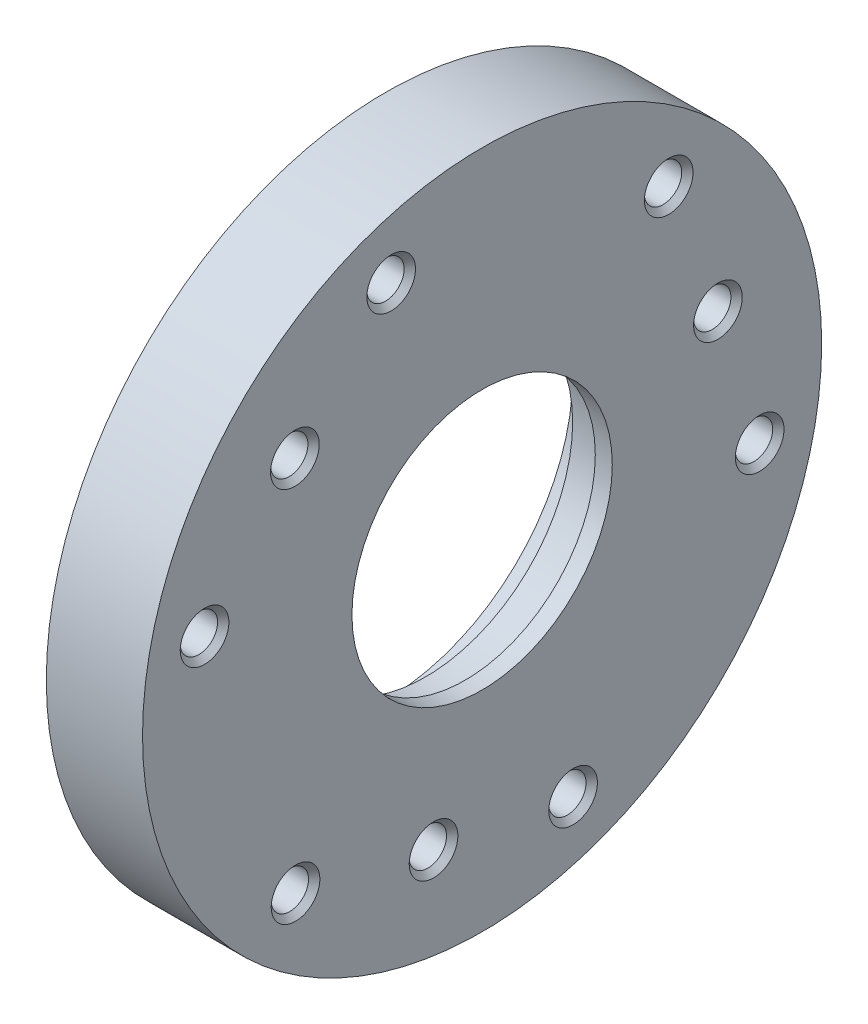
from build123d import *

# Parameters (mm, degrees)
SKETCH2_R          = 2.5
CUT_EXTRUDE1_DEPTH = 4
SKETCH3_R          = 3.075
CUT_EXTRUDE4_DEPTH = 87.539008545
SKETCH5_R          = 3.3
CUT_EXTRUDE6_DEPTH = 10
CHAMFER1_SIZE      = 1
SKETCH7_R          = 1
CUT_EXTRUDE8_DEPTH = 1


with BuildPart() as part:
    # Sketch1 → Revolve1 (revolve)
    with BuildSketch(Plane.XY):
        Polygon((0, 60), (0, 33), (7, 33), (7, 26), (14, 26), (14, 23), (17, 23), (17, 60), align=None)
    revolve(axis=Axis((0, 0, 0), (1, 0, 0)))

    # Sketch2 → Cut-Extrude1 (cut)
    with BuildSketch(Plane.ZY):
        with Locations((0, 40)):
            Circle(SKETCH2_R)
        with Locations((15.307337295, 36.9551813)):
            Circle(SKETCH2_R)
        with Locations((28.284271247, 28.284271247)):
            Circle(SKETCH2_R)
        with Locations((36.9551813, 15.307337295)):
            Circle(SKETCH2_R)
        with Locations((40, 0)):
            Circle(SKETCH2_R)
        with Locations((36.9551813, -15.307337295)):
            Circle(SKETCH2_R)
        with Locations((28.284271247, -28.284271247)):
            Circle(SKETCH2_R)
        with Locations((15.307337295, -36.9551813)):
            Circle(SKETCH2_R)
        with Locations((0, -40)):
            Circle(SKETCH2_R)
        with Locations((-15.307337295, -36.9551813)):
            Circle(SKETCH2_R)
        with Locations((-28.284271247, -28.284271247)):
            Circle(SKETCH2_R)
        with Locations((-36.9551813, -15.307337295)):
            Circle(SKETCH2_R)
        with Locations((-40, 0)):
            Circle(SKETCH2_R)
        with Locations((-36.9551813, 15.307337295)):
            Circle(SKETCH2_R)
        with Locations((-28.284271247, 28.284271247)):
            Circle(SKETCH2_R)
        with Locations((-15.307337295, 36.9551813)):
            Circle(SKETCH2_R)
    extrude(amount=-CUT_EXTRUDE1_DEPTH, mode=Mode.SUBTRACT)

    # Sketch3 → Cut-Extrude4 (cut, through all)
    with BuildSketch(Plane(origin=(17, 0, 0), x_dir=(0, 0, -1), z_dir=(1, 0, 0))):
        with Locations((49.03926402, -9.754516101)):
            Circle(SKETCH3_R)
        with Locations((16.071973265, -47.346506475)):
            Circle(SKETCH3_R)
        with Locations((-32.967290755, -37.591990374)):
            Circle(SKETCH3_R)
        with Locations((-49.03926402, 9.754516101)):
            Circle(SKETCH3_R)
        with Locations((-16.071973265, 47.346506475)):
            Circle(SKETCH3_R)
        with Locations((32.967290755, 37.591990374)):
            Circle(SKETCH3_R)
    extrude(amount=-CUT_EXTRUDE4_DEPTH, mode=Mode.SUBTRACT)

    # Sketch5 → Cut-Extrude6 (cut)
    with BuildSketch(Plane(origin=(17, 0, 0), x_dir=(0, 0, -1), z_dir=(1, 0, 0))):
        with Locations((32.967290755, 37.591990374)):
            Circle(SKETCH5_R)
        with Locations((49.03926402, -9.754516101)):
            Circle(SKETCH5_R)
        with Locations((16.071973265, -47.346506475)):
            Circle(SKETCH5_R)
        with Locations((-32.967290755, -37.591990374)):
            Circle(SKETCH5_R)
        with Locations((-49.03926402, 9.754516101)):
            Circle(SKETCH5_R)
        with Locations((-16.071973265, 47.346506475)):
            Circle(SKETCH5_R)
        with Locations((41.664925698, 14.143336473)):
            Circle(SKETCH5_R)
        with Locations((-8.583974169, -43.154552338)):
            Circle(SKETCH5_R)
        with Locations((-33.080951529, 29.011215864)):
            Circle(SKETCH5_R)
    extrude(amount=-CUT_EXTRUDE6_DEPTH, mode=Mode.SUBTRACT)

    # Chamfer1
    chamfer1_edges = [part.edges().sort_by_distance(p)[0] for p in [
        (17, 47.346506475, 19.371973265),
        (17, 29.011215864, 36.380951529),
        (17, 9.754516101, 52.33926402),
        (17, -37.591990374, 36.267290755),
        (17, -43.154552338, 11.883974169),
        (17, -47.346506475, -12.771973265),
        (17, -9.754516101, -45.73926402),
        (17, 14.143336473, -38.364925698),
        (17, 37.591990374, -29.667290755),
    ]]
    chamfer(chamfer1_edges, length=CHAMFER1_SIZE)

    # Sketch7 → Cut-Extrude8 (cut)
    with BuildSketch(Plane.ZY):
        with Locations((39.086428505, -31.895390573)):
            Circle(SKETCH7_R)
    extrude(amount=-CUT_EXTRUDE8_DEPTH, mode=Mode.SUBTRACT)


solid = part.part
